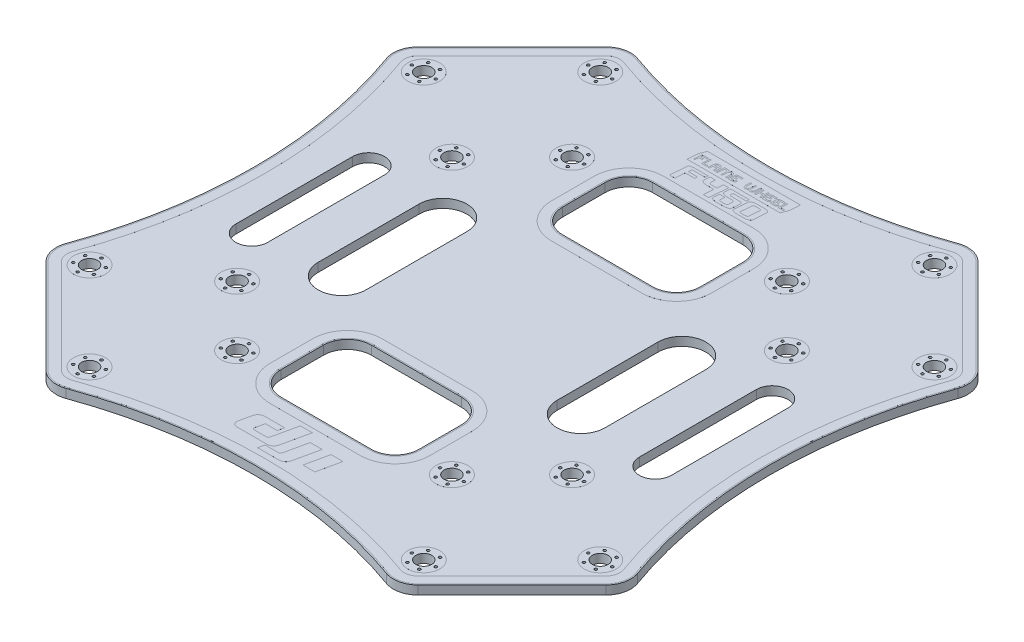
from build123d import *

# Parameters (mm, degrees)
BOSS_EXTRUDE1_DEPTH      = 0.825
BOSS_EXTRUDE1_DEPTH_BACK = 0.825
CUT_EXTRUDE1_DEPTH       = 1.65
SKETCH3_R                = 1.5
CUT_EXTRUDE2_DEPTH       = 1.65
BOSS_EXTRUDE2_START      = 0.001
SKETCH4_R                = 3
SKETCH4_R_2              = 0.25
SKETCH4_R_3              = 1.5
BOSS_EXTRUDE2_DEPTH      = 0.001
SKETCH5_R                = 0.25
CUT_EXTRUDE3_DEPTH       = 1.65
BOSS_EXTRUDE3_DEPTH      = 0.001


# Read off the part's stored shape, not the designer's step: Boss-Extrude3
with BuildPart() as part:
    # Sketch1 → Boss-Extrude1 (new, two sides: drawn at the far end of the back side and taken through both)
    with BuildSketch(Plane(origin=(0, 0, 0), x_dir=(1, 0, 0), z_dir=(0, 1, 0)).offset(-BOSS_EXTRUDE1_DEPTH_BACK)):
        with BuildLine():
            Line((35.046361717, 52.705589829), (52.705589829, 35.046361717))
            ThreePointArc((52.705589829, 35.046361717), (53.961944938, 32.762265708), (53.8, 30.160478519))
            ThreePointArc((53.8, 30.160478519), (48.55, 0), (53.8, -30.160478519))
            ThreePointArc((53.8, -30.160478519), (53.961944938, -32.762265708), (52.705589829, -35.046361717))
            Line((52.705589829, -35.046361717), (35.046361717, -52.705589829))
            ThreePointArc((35.046361717, -52.705589829), (32.762265708, -53.961944938), (30.160478519, -53.8))
            ThreePointArc((30.160478519, -53.8), (0, -48.55), (-30.160478519, -53.8))
            ThreePointArc((-30.160478519, -53.8), (-32.762265708, -53.961944938), (-35.046361717, -52.705589829))
            Line((-35.046361717, -52.705589829), (-52.705589829, -35.046361717))
            ThreePointArc((-52.705589829, -35.046361717), (-53.961944938, -32.762265708), (-53.8, -30.160478519))
            ThreePointArc((-53.8, -30.160478519), (-48.55, 0), (-53.8, 30.160478519))
            ThreePointArc((-53.8, 30.160478519), (-53.961944938, 32.762265708), (-52.705589829, 35.046361717))
            Line((-52.705589829, 35.046361717), (-35.046361717, 52.705589829))
            ThreePointArc((-35.046361717, 52.705589829), (-32.762265708, 53.961944938), (-30.160478519, 53.8))
            ThreePointArc((-30.160478519, 53.8), (0, 48.55), (30.160478519, 53.8))
            ThreePointArc((30.160478519, 53.8), (32.762265708, 53.961944938), (35.046361717, 52.705589829))
        make_face()
    extrude(amount=BOSS_EXTRUDE1_DEPTH + BOSS_EXTRUDE1_DEPTH_BACK)

    # Sketch2 → Cut-Extrude1 (cut)
    with BuildSketch(Plane(origin=(0, 0.825, 0), x_dir=(1, 0, 0), z_dir=(0, 1, 0))):
        with BuildLine():
            Line((13, 30.5), (13, 22.5))
            ThreePointArc((13, 22.5), (11.681980515, 19.318019485), (8.5, 18))
            Line((8.5, 18), (-8.5, 18))
            ThreePointArc((-8.5, 18), (-11.681980515, 19.318019485), (-13, 22.5))
            Line((-13, 22.5), (-13, 30.5))
            ThreePointArc((-13, 30.5), (-11.681980515, 33.681980515), (-8.5, 35))
            Line((-8.5, 35), (8.5, 35))
            ThreePointArc((8.5, 35), (11.681980515, 33.681980515), (13, 30.5))
        make_face()
        with BuildLine():
            Line((-13, -22.5), (-13, -30.5))
            ThreePointArc((-13, -30.5), (-11.681980515, -33.681980515), (-8.5, -35))
            Line((-8.5, -35), (8.5, -35))
            ThreePointArc((8.5, -35), (11.681980515, -33.681980515), (13, -30.5))
            Line((13, -30.5), (13, -22.5))
            ThreePointArc((13, -22.5), (11.681980515, -19.318019485), (8.5, -18))
            Line((8.5, -18), (-8.5, -18))
            ThreePointArc((-8.5, -18), (-11.681980515, -19.318019485), (-13, -22.5))
        make_face()
        with BuildLine():
            Line((-27, -9.5), (-27, 9.5))
            ThreePointArc((-27, 9.5), (-22.5, 14), (-18, 9.5))
            Line((-18, 9.5), (-18, -9.5))
            ThreePointArc((-18, -9.5), (-22.5, -14), (-27, -9.5))
        make_face()
        with BuildLine():
            Line((18, -9.5), (18, 9.5))
            ThreePointArc((18, 9.5), (22.5, 14), (27, 9.5))
            Line((27, 9.5), (27, -9.5))
            ThreePointArc((27, -9.5), (22.5, -14), (18, -9.5))
        make_face()
        with BuildLine():
            Line((-35, 11), (-35, -11))
            ThreePointArc((-35, -11), (-38, -14), (-41, -11))
            Line((-41, -11), (-41, 11))
            ThreePointArc((-41, 11), (-38, 14), (-35, 11))
        make_face()
        with BuildLine():
            Line((35, 11), (35, -11))
            ThreePointArc((35, -11), (38, -14), (41, -11))
            Line((41, -11), (41, 11))
            ThreePointArc((41, 11), (38, 14), (35, 11))
        make_face()
    extrude(amount=-CUT_EXTRUDE1_DEPTH, mode=Mode.SUBTRACT)

    # Sketch3 → Cut-Extrude2 (cut)
    with BuildSketch(Plane(origin=(0, 0.825, 0), x_dir=(1, 0, 0), z_dir=(0, 1, 0))):
        with Locations(Location((-48.083261121, -31.466251763, 0), (0, 0, 270))):
            Circle(SKETCH3_R)
        with Locations(Location((-31.466251763, -48.083261121, 0), (0, 0, 270))):
            Circle(SKETCH3_R)
        with Locations(Location((31.466251763, -48.083261121, 0), (0, 0, 270))):
            Circle(SKETCH3_R)
        with Locations(Location((48.083261121, -31.466251763, 0), (0, 0, 270))):
            Circle(SKETCH3_R)
        with Locations(Location((48.083261121, 31.466251763, 0), (0, 0, 270))):
            Circle(SKETCH3_R)
        with Locations(Location((31.466251763, 48.083261121, 0), (0, 0, 270))):
            Circle(SKETCH3_R)
        with Locations(Location((-31.466251763, 48.083261121, 0), (0, 0, 270))):
            Circle(SKETCH3_R)
        with Locations(Location((-48.083261121, 31.466251763, 0), (0, 0, 270))):
            Circle(SKETCH3_R)
        with Locations(Location((-31.540291459, -20.22658296, 0), (0, 0, 270))):
            Circle(SKETCH3_R)
        with Locations(Location((-20.22658296, -31.540291459, 0), (0, 0, 270))):
            Circle(SKETCH3_R)
        with Locations(Location((-31.540291459, 20.22658296, 0), (0, 0, 270))):
            Circle(SKETCH3_R)
        with Locations(Location((-20.22658296, 31.540291459, 0), (0, 0, 270))):
            Circle(SKETCH3_R)
        with Locations(Location((20.22658296, 31.540291459, 0), (0, 0, 270))):
            Circle(SKETCH3_R)
        with Locations(Location((31.540291459, 20.22658296, 0), (0, 0, 270))):
            Circle(SKETCH3_R)
        with Locations(Location((31.540291459, -20.22658296, 0), (0, 0, 270))):
            Circle(SKETCH3_R)
        with Locations(Location((20.22658296, -31.540291459, 0), (0, 0, 270))):
            Circle(SKETCH3_R)
    extrude(amount=-CUT_EXTRUDE2_DEPTH, mode=Mode.SUBTRACT)

    # Sketch4 → Boss-Extrude2 (add)
    # profile 1 of 19: a face of its own
    with BuildSketch(Plane(origin=(0, 0.825, 0), x_dir=(1, 0, 0), z_dir=(0, 1, 0)).offset(BOSS_EXTRUDE2_START)):
        with BuildLine():
            ThreePointArc((30.244953362, -53.564704439), (32.707621199, -53.71799007), (34.869585021, -52.528813133))
            Line((34.869585021, -52.528813133), (52.528813133, -34.869585021))
            ThreePointArc((52.528813133, -34.869585021), (53.71799007, -32.707621199), (53.564704439, -30.244953362))
            ThreePointArc((53.564704439, -30.244953362), (48.3, 0), (53.564704439, 30.244953362))
            ThreePointArc((53.564704439, 30.244953362), (53.71799007, 32.707621199), (52.528813133, 34.869585021))
            Line((52.528813133, 34.869585021), (34.869585021, 52.528813133))
            ThreePointArc((34.869585021, 52.528813133), (32.707621199, 53.71799007), (30.244953362, 53.564704439))
            ThreePointArc((30.244953362, 53.564704439), (0, 48.3), (-30.244953362, 53.564704439))
            ThreePointArc((-30.244953362, 53.564704439), (-32.707621199, 53.71799007), (-34.869585021, 52.528813133))
            Line((-34.869585021, 52.528813133), (-52.528813133, 34.869585021))
            ThreePointArc((-52.528813133, 34.869585021), (-53.71799007, 32.707621199), (-53.564704439, 30.244953362))
            ThreePointArc((-53.564704439, 30.244953362), (-48.3, 0), (-53.564704439, -30.244953362))
            ThreePointArc((-53.564704439, -30.244953362), (-53.71799007, -32.707621199), (-52.528813133, -34.869585021))
            Line((-52.528813133, -34.869585021), (-34.869585021, -52.528813133))
            ThreePointArc((-34.869585021, -52.528813133), (-32.707621199, -53.71799007), (-30.244953362, -53.564704439))
            ThreePointArc((-30.244953362, -53.564704439), (0, -48.3), (30.244953362, -53.564704439))
        make_face()
        with BuildLine():
            ThreePointArc((-51.870576403, 30.853172233), (-51.961515021, 32.314180733), (-51.256020927, 33.596792815))
            Line((-51.256020927, 33.596792815), (-33.596792815, 51.256020927))
            ThreePointArc((-33.596792815, 51.256020927), (-32.314180733, 51.961515021), (-30.853172233, 51.870576403))
            ThreePointArc((-30.853172233, 51.870576403), (0, 46.5), (30.853172233, 51.870576403))
            ThreePointArc((30.853172233, 51.870576403), (32.314180733, 51.961515021), (33.596792815, 51.256020927))
            Line((33.596792815, 51.256020927), (51.256020927, 33.596792815))
            ThreePointArc((51.256020927, 33.596792815), (51.961515021, 32.314180733), (51.870576403, 30.853172233))
            ThreePointArc((51.870576403, 30.853172233), (46.5, 0), (51.870576403, -30.853172233))
            ThreePointArc((51.870576403, -30.853172233), (51.961515021, -32.314180733), (51.256020927, -33.596792815))
            Line((51.256020927, -33.596792815), (33.596792815, -51.256020927))
            ThreePointArc((33.596792815, -51.256020927), (32.314180733, -51.961515021), (30.853172233, -51.870576403))
            ThreePointArc((30.853172233, -51.870576403), (0, -46.5), (-30.853172233, -51.870576403))
            ThreePointArc((-30.853172233, -51.870576403), (-32.314180733, -51.961515021), (-33.596792815, -51.256020927))
            Line((-33.596792815, -51.256020927), (-51.256020927, -33.596792815))
            ThreePointArc((-51.256020927, -33.596792815), (-51.961515021, -32.314180733), (-51.870576403, -30.853172233))
            ThreePointArc((-51.870576403, -30.853172233), (-46.5, 0), (-51.870576403, 30.853172233))
        make_face(mode=Mode.SUBTRACT)
    # profile 2 of 19: a face of its own
    with BuildSketch(Plane(origin=(0, 0.825, 0), x_dir=(1, 0, 0), z_dir=(0, 1, 0)).offset(BOSS_EXTRUDE2_START)):
        with BuildLine():
            Line((15.05, 22.5), (15.05, 30.5))
            ThreePointArc((15.05, 30.5), (13.131549417, 35.131549417), (8.5, 37.05))
            Line((8.5, 37.05), (-8.5, 37.05))
            ThreePointArc((-8.5, 37.05), (-13.131549417, 35.131549417), (-15.05, 30.5))
            Line((-15.05, 30.5), (-15.05, 22.5))
            ThreePointArc((-15.05, 22.5), (-13.131549417, 17.868450583), (-8.5, 15.95))
            Line((-8.5, 15.95), (8.5, 15.95))
            ThreePointArc((8.5, 15.95), (13.131549417, 17.868450583), (15.05, 22.5))
        make_face()
        with BuildLine():
            Line((8.5, 17.75), (-8.5, 17.75))
            ThreePointArc((-8.5, 17.75), (-11.858757211, 19.141242789), (-13.25, 22.5))
            Line((-13.25, 22.5), (-13.25, 30.5))
            ThreePointArc((-13.25, 30.5), (-11.858757211, 33.858757211), (-8.5, 35.25))
            Line((-8.5, 35.25), (8.5, 35.25))
            ThreePointArc((8.5, 35.25), (11.858757211, 33.858757211), (13.25, 30.5))
            Line((13.25, 30.5), (13.25, 22.5))
            ThreePointArc((13.25, 22.5), (11.858757211, 19.141242789), (8.5, 17.75))
        make_face(mode=Mode.SUBTRACT)
    # profile 3 of 19: a face of its own
    with BuildSketch(Plane(origin=(0, 0.825, 0), x_dir=(1, 0, 0), z_dir=(0, 1, 0)).offset(BOSS_EXTRUDE2_START)):
        with BuildLine():
            ThreePointArc((8.5, -37.05), (13.131549417, -35.131549417), (15.05, -30.5))
            Line((15.05, -30.5), (15.05, -22.5))
            ThreePointArc((15.05, -22.5), (13.131549417, -17.868450583), (8.5, -15.95))
            Line((8.5, -15.95), (-8.5, -15.95))
            ThreePointArc((-8.5, -15.95), (-13.131549417, -17.868450583), (-15.05, -22.5))
            Line((-15.05, -22.5), (-15.05, -30.5))
            ThreePointArc((-15.05, -30.5), (-13.131549417, -35.131549417), (-8.5, -37.05))
            Line((-8.5, -37.05), (8.5, -37.05))
        make_face()
        with BuildLine():
            Line((13.25, -22.5), (13.25, -30.5))
            ThreePointArc((13.25, -30.5), (11.858757211, -33.858757211), (8.5, -35.25))
            Line((8.5, -35.25), (-8.5, -35.25))
            ThreePointArc((-8.5, -35.25), (-11.858757211, -33.858757211), (-13.25, -30.5))
            Line((-13.25, -30.5), (-13.25, -22.5))
            ThreePointArc((-13.25, -22.5), (-11.858757211, -19.141242789), (-8.5, -17.75))
            Line((-8.5, -17.75), (8.5, -17.75))
            ThreePointArc((8.5, -17.75), (11.858757211, -19.141242789), (13.25, -22.5))
        make_face(mode=Mode.SUBTRACT)
    # profile 4 of 19: a face of its own
    with BuildSketch(Plane(origin=(0, 0.825, 0), x_dir=(1, 0, 0), z_dir=(0, 1, 0)).offset(BOSS_EXTRUDE2_START)):
        with Locations(Location((-31.466251763, -48.083261121, 0), (0, 0, 270))):
            Circle(SKETCH4_R)
        with Locations(Location((-33.414808921, -49.208261121, 0), (0, 0, 270))):
            Circle(SKETCH4_R_2, mode=Mode.SUBTRACT)
        with Locations(Location((-31.466251763, -50.333261121, 0), (0, 0, 270))):
            Circle(SKETCH4_R_2, mode=Mode.SUBTRACT)
        with Locations(Location((-31.466251763, -48.083261121, 0), (0, 0, 270))):
            Circle(SKETCH4_R_3, mode=Mode.SUBTRACT)
        with Locations(Location((-29.517694604, -49.208261121, 0), (0, 0, 270))):
            Circle(SKETCH4_R_2, mode=Mode.SUBTRACT)
        with Locations(Location((-33.414808921, -46.958261121, 0), (0, 0, 270))):
            Circle(SKETCH4_R_2, mode=Mode.SUBTRACT)
        with Locations(Location((-31.466251763, -45.833261121, 0), (0, 0, 270))):
            Circle(SKETCH4_R_2, mode=Mode.SUBTRACT)
        with Locations(Location((-29.517694604, -46.958261121, 0), (0, 0, 270))):
            Circle(SKETCH4_R_2, mode=Mode.SUBTRACT)
    # profile 5 of 19: a face of its own
    with BuildSketch(Plane(origin=(0, 0.825, 0), x_dir=(1, 0, 0), z_dir=(0, 1, 0)).offset(BOSS_EXTRUDE2_START)):
        with Locations(Location((-48.083261121, -31.466251763, 0), (0, 0, 270))):
            Circle(SKETCH4_R)
        with Locations(Location((-48.083261121, -33.716251763, 0), (0, 0, 270))):
            Circle(SKETCH4_R_2, mode=Mode.SUBTRACT)
        with Locations(Location((-50.031818279, -32.591251763, 0), (0, 0, 270))):
            Circle(SKETCH4_R_2, mode=Mode.SUBTRACT)
        with Locations(Location((-50.031818279, -30.341251763, 0), (0, 0, 270))):
            Circle(SKETCH4_R_2, mode=Mode.SUBTRACT)
        with Locations(Location((-48.083261121, -31.466251763, 0), (0, 0, 270))):
            Circle(SKETCH4_R_3, mode=Mode.SUBTRACT)
        with Locations(Location((-48.083261121, -29.216251763, 0), (0, 0, 270))):
            Circle(SKETCH4_R_2, mode=Mode.SUBTRACT)
        with Locations(Location((-46.134703962, -32.591251763, 0), (0, 0, 270))):
            Circle(SKETCH4_R_2, mode=Mode.SUBTRACT)
        with Locations(Location((-46.134703962, -30.341251763, 0), (0, 0, 270))):
            Circle(SKETCH4_R_2, mode=Mode.SUBTRACT)
    # profile 6 of 19: a face of its own
    with BuildSketch(Plane(origin=(0, 0.825, 0), x_dir=(1, 0, 0), z_dir=(0, 1, 0)).offset(BOSS_EXTRUDE2_START)):
        with Locations(Location((-31.540291459, -20.22658296, 0), (0, 0, 270))):
            Circle(SKETCH4_R)
        with Locations(Location((-31.540291459, -22.47658296, 0), (0, 0, 270))):
            Circle(SKETCH4_R_2, mode=Mode.SUBTRACT)
        with Locations(Location((-33.488848618, -21.35158296, 0), (0, 0, 270))):
            Circle(SKETCH4_R_2, mode=Mode.SUBTRACT)
        with Locations(Location((-31.540291459, -20.22658296, 0), (0, 0, 270))):
            Circle(SKETCH4_R_3, mode=Mode.SUBTRACT)
        with Locations(Location((-29.591734301, -21.35158296, 0), (0, 0, 270))):
            Circle(SKETCH4_R_2, mode=Mode.SUBTRACT)
        with Locations(Location((-33.488848618, -19.10158296, 0), (0, 0, 270))):
            Circle(SKETCH4_R_2, mode=Mode.SUBTRACT)
        with Locations(Location((-31.540291459, -17.97658296, 0), (0, 0, 270))):
            Circle(SKETCH4_R_2, mode=Mode.SUBTRACT)
        with Locations(Location((-29.591734301, -19.10158296, 0), (0, 0, 270))):
            Circle(SKETCH4_R_2, mode=Mode.SUBTRACT)
    # profile 7 of 19: a face of its own
    with BuildSketch(Plane(origin=(0, 0.825, 0), x_dir=(1, 0, 0), z_dir=(0, 1, 0)).offset(BOSS_EXTRUDE2_START)):
        with Locations(Location((-20.22658296, -31.540291459, 0), (0, 0, 270))):
            Circle(SKETCH4_R)
        with Locations(Location((-20.22658296, -33.790291459, 0), (0, 0, 270))):
            Circle(SKETCH4_R_2, mode=Mode.SUBTRACT)
        with Locations(Location((-22.175140119, -32.665291459, 0), (0, 0, 270))):
            Circle(SKETCH4_R_2, mode=Mode.SUBTRACT)
        with Locations(Location((-22.175140119, -30.415291459, 0), (0, 0, 270))):
            Circle(SKETCH4_R_2, mode=Mode.SUBTRACT)
        with Locations(Location((-20.22658296, -31.540291459, 0), (0, 0, 270))):
            Circle(SKETCH4_R_3, mode=Mode.SUBTRACT)
        with Locations(Location((-20.22658296, -29.290291459, 0), (0, 0, 270))):
            Circle(SKETCH4_R_2, mode=Mode.SUBTRACT)
        with Locations(Location((-18.278025802, -32.665291459, 0), (0, 0, 270))):
            Circle(SKETCH4_R_2, mode=Mode.SUBTRACT)
        with Locations(Location((-18.278025802, -30.415291459, 0), (0, 0, 270))):
            Circle(SKETCH4_R_2, mode=Mode.SUBTRACT)
    # profile 8 of 19: a face of its own
    with BuildSketch(Plane(origin=(0, 0.825, 0), x_dir=(1, 0, 0), z_dir=(0, 1, 0)).offset(BOSS_EXTRUDE2_START)):
        with Locations(Location((-48.083261121, 31.466251763, 0), (0, 0, 270))):
            Circle(SKETCH4_R)
        with Locations(Location((-49.208261121, 29.517694604, 0), (0, 0, 270))):
            Circle(SKETCH4_R_2, mode=Mode.SUBTRACT)
        with Locations(Location((-50.333261121, 31.466251763, 0), (0, 0, 270))):
            Circle(SKETCH4_R_2, mode=Mode.SUBTRACT)
        with Locations(Location((-48.083261121, 31.466251763, 0), (0, 0, 270))):
            Circle(SKETCH4_R_3, mode=Mode.SUBTRACT)
        with Locations(Location((-49.208261121, 33.414808921, 0), (0, 0, 270))):
            Circle(SKETCH4_R_2, mode=Mode.SUBTRACT)
        with Locations(Location((-46.958261121, 29.517694604, 0), (0, 0, 270))):
            Circle(SKETCH4_R_2, mode=Mode.SUBTRACT)
        with Locations(Location((-45.833261121, 31.466251763, 0), (0, 0, 270))):
            Circle(SKETCH4_R_2, mode=Mode.SUBTRACT)
        with Locations(Location((-46.958261121, 33.414808921, 0), (0, 0, 270))):
            Circle(SKETCH4_R_2, mode=Mode.SUBTRACT)
    # profile 9 of 19: a face of its own
    with BuildSketch(Plane(origin=(0, 0.825, 0), x_dir=(1, 0, 0), z_dir=(0, 1, 0)).offset(BOSS_EXTRUDE2_START)):
        with Locations(Location((-31.540291459, 20.22658296, 0), (0, 0, 270))):
            Circle(SKETCH4_R)
        with Locations(Location((-32.665291459, 18.278025802, 0), (0, 0, 270))):
            Circle(SKETCH4_R_2, mode=Mode.SUBTRACT)
        with Locations(Location((-30.415291459, 18.278025802, 0), (0, 0, 270))):
            Circle(SKETCH4_R_2, mode=Mode.SUBTRACT)
        with Locations(Location((-33.790291459, 20.22658296, 0), (0, 0, 270))):
            Circle(SKETCH4_R_2, mode=Mode.SUBTRACT)
        with Locations(Location((-31.540291459, 20.22658296, 0), (0, 0, 270))):
            Circle(SKETCH4_R_3, mode=Mode.SUBTRACT)
        with Locations(Location((-32.665291459, 22.175140119, 0), (0, 0, 270))):
            Circle(SKETCH4_R_2, mode=Mode.SUBTRACT)
        with Locations(Location((-30.415291459, 22.175140119, 0), (0, 0, 270))):
            Circle(SKETCH4_R_2, mode=Mode.SUBTRACT)
        with Locations(Location((-29.290291459, 20.22658296, 0), (0, 0, 270))):
            Circle(SKETCH4_R_2, mode=Mode.SUBTRACT)
    # profile 10 of 19: a face of its own
    with BuildSketch(Plane(origin=(0, 0.825, 0), x_dir=(1, 0, 0), z_dir=(0, 1, 0)).offset(BOSS_EXTRUDE2_START)):
        with Locations(Location((-20.22658296, 31.540291459, 0), (0, 0, 270))):
            Circle(SKETCH4_R)
        with Locations(Location((-21.35158296, 29.591734301, 0), (0, 0, 270))):
            Circle(SKETCH4_R_2, mode=Mode.SUBTRACT)
        with Locations(Location((-22.47658296, 31.540291459, 0), (0, 0, 270))):
            Circle(SKETCH4_R_2, mode=Mode.SUBTRACT)
        with Locations(Location((-20.22658296, 31.540291459, 0), (0, 0, 270))):
            Circle(SKETCH4_R_3, mode=Mode.SUBTRACT)
        with Locations(Location((-21.35158296, 33.488848618, 0), (0, 0, 270))):
            Circle(SKETCH4_R_2, mode=Mode.SUBTRACT)
        with Locations(Location((-19.10158296, 29.591734301, 0), (0, 0, 270))):
            Circle(SKETCH4_R_2, mode=Mode.SUBTRACT)
        with Locations(Location((-17.97658296, 31.540291459, 0), (0, 0, 270))):
            Circle(SKETCH4_R_2, mode=Mode.SUBTRACT)
        with Locations(Location((-19.10158296, 33.488848618, 0), (0, 0, 270))):
            Circle(SKETCH4_R_2, mode=Mode.SUBTRACT)
    # profile 11 of 19: a face of its own
    with BuildSketch(Plane(origin=(0, 0.825, 0), x_dir=(1, 0, 0), z_dir=(0, 1, 0)).offset(BOSS_EXTRUDE2_START)):
        with Locations(Location((-31.466251763, 48.083261121, 0), (0, 0, 270))):
            Circle(SKETCH4_R)
        with Locations(Location((-32.591251763, 46.134703962, 0), (0, 0, 270))):
            Circle(SKETCH4_R_2, mode=Mode.SUBTRACT)
        with Locations(Location((-30.341251763, 46.134703962, 0), (0, 0, 270))):
            Circle(SKETCH4_R_2, mode=Mode.SUBTRACT)
        with Locations(Location((-33.716251763, 48.083261121, 0), (0, 0, 270))):
            Circle(SKETCH4_R_2, mode=Mode.SUBTRACT)
        with Locations(Location((-31.466251763, 48.083261121, 0), (0, 0, 270))):
            Circle(SKETCH4_R_3, mode=Mode.SUBTRACT)
        with Locations(Location((-32.591251763, 50.031818279, 0), (0, 0, 270))):
            Circle(SKETCH4_R_2, mode=Mode.SUBTRACT)
        with Locations(Location((-30.341251763, 50.031818279, 0), (0, 0, 270))):
            Circle(SKETCH4_R_2, mode=Mode.SUBTRACT)
        with Locations(Location((-29.216251763, 48.083261121, 0), (0, 0, 270))):
            Circle(SKETCH4_R_2, mode=Mode.SUBTRACT)
    # profile 12 of 19: a face of its own
    with BuildSketch(Plane(origin=(0, 0.825, 0), x_dir=(1, 0, 0), z_dir=(0, 1, 0)).offset(BOSS_EXTRUDE2_START)):
        with Locations(Location((20.22658296, 31.540291459, 0), (0, 0, 270))):
            Circle(SKETCH4_R)
        with Locations(Location((18.278025802, 30.415291459, 0), (0, 0, 270))):
            Circle(SKETCH4_R_2, mode=Mode.SUBTRACT)
        with Locations(Location((18.278025802, 32.665291459, 0), (0, 0, 270))):
            Circle(SKETCH4_R_2, mode=Mode.SUBTRACT)
        with Locations(Location((20.22658296, 29.290291459, 0), (0, 0, 270))):
            Circle(SKETCH4_R_2, mode=Mode.SUBTRACT)
        with Locations(Location((20.22658296, 31.540291459, 0), (0, 0, 270))):
            Circle(SKETCH4_R_3, mode=Mode.SUBTRACT)
        with Locations(Location((22.175140119, 30.415291459, 0), (0, 0, 270))):
            Circle(SKETCH4_R_2, mode=Mode.SUBTRACT)
        with Locations(Location((22.175140119, 32.665291459, 0), (0, 0, 270))):
            Circle(SKETCH4_R_2, mode=Mode.SUBTRACT)
        with Locations(Location((20.22658296, 33.790291459, 0), (0, 0, 270))):
            Circle(SKETCH4_R_2, mode=Mode.SUBTRACT)
    # profile 13 of 19: a face of its own
    with BuildSketch(Plane(origin=(0, 0.825, 0), x_dir=(1, 0, 0), z_dir=(0, 1, 0)).offset(BOSS_EXTRUDE2_START)):
        with Locations(Location((31.466251763, 48.083261121, 0), (0, 0, 270))):
            Circle(SKETCH4_R)
        with Locations(Location((29.517694604, 46.958261121, 0), (0, 0, 270))):
            Circle(SKETCH4_R_2, mode=Mode.SUBTRACT)
        with Locations(Location((31.466251763, 45.833261121, 0), (0, 0, 270))):
            Circle(SKETCH4_R_2, mode=Mode.SUBTRACT)
        with Locations(Location((33.414808921, 46.958261121, 0), (0, 0, 270))):
            Circle(SKETCH4_R_2, mode=Mode.SUBTRACT)
        with Locations(Location((29.517694604, 49.208261121, 0), (0, 0, 270))):
            Circle(SKETCH4_R_2, mode=Mode.SUBTRACT)
        with Locations(Location((31.466251763, 48.083261121, 0), (0, 0, 270))):
            Circle(SKETCH4_R_3, mode=Mode.SUBTRACT)
        with Locations(Location((31.466251763, 50.333261121, 0), (0, 0, 270))):
            Circle(SKETCH4_R_2, mode=Mode.SUBTRACT)
        with Locations(Location((33.414808921, 49.208261121, 0), (0, 0, 270))):
            Circle(SKETCH4_R_2, mode=Mode.SUBTRACT)
    # profile 14 of 19: a face of its own
    with BuildSketch(Plane(origin=(0, 0.825, 0), x_dir=(1, 0, 0), z_dir=(0, 1, 0)).offset(BOSS_EXTRUDE2_START)):
        with Locations(Location((48.083261121, 31.466251763, 0), (0, 0, 270))):
            Circle(SKETCH4_R)
        with Locations(Location((46.134703962, 30.341251763, 0), (0, 0, 270))):
            Circle(SKETCH4_R_2, mode=Mode.SUBTRACT)
        with Locations(Location((46.134703962, 32.591251763, 0), (0, 0, 270))):
            Circle(SKETCH4_R_2, mode=Mode.SUBTRACT)
        with Locations(Location((48.083261121, 29.216251763, 0), (0, 0, 270))):
            Circle(SKETCH4_R_2, mode=Mode.SUBTRACT)
        with Locations(Location((48.083261121, 31.466251763, 0), (0, 0, 270))):
            Circle(SKETCH4_R_3, mode=Mode.SUBTRACT)
        with Locations(Location((50.031818279, 30.341251763, 0), (0, 0, 270))):
            Circle(SKETCH4_R_2, mode=Mode.SUBTRACT)
        with Locations(Location((50.031818279, 32.591251763, 0), (0, 0, 270))):
            Circle(SKETCH4_R_2, mode=Mode.SUBTRACT)
        with Locations(Location((48.083261121, 33.716251763, 0), (0, 0, 270))):
            Circle(SKETCH4_R_2, mode=Mode.SUBTRACT)
    # profile 15 of 19: a face of its own
    with BuildSketch(Plane(origin=(0, 0.825, 0), x_dir=(1, 0, 0), z_dir=(0, 1, 0)).offset(BOSS_EXTRUDE2_START)):
        with Locations(Location((31.540291459, 20.22658296, 0), (0, 0, 270))):
            Circle(SKETCH4_R)
        with Locations(Location((29.591734301, 19.10158296, 0), (0, 0, 270))):
            Circle(SKETCH4_R_2, mode=Mode.SUBTRACT)
        with Locations(Location((31.540291459, 17.97658296, 0), (0, 0, 270))):
            Circle(SKETCH4_R_2, mode=Mode.SUBTRACT)
        with Locations(Location((33.488848618, 19.10158296, 0), (0, 0, 270))):
            Circle(SKETCH4_R_2, mode=Mode.SUBTRACT)
        with Locations(Location((29.591734301, 21.35158296, 0), (0, 0, 270))):
            Circle(SKETCH4_R_2, mode=Mode.SUBTRACT)
        with Locations(Location((31.540291459, 20.22658296, 0), (0, 0, 270))):
            Circle(SKETCH4_R_3, mode=Mode.SUBTRACT)
        with Locations(Location((33.488848618, 21.35158296, 0), (0, 0, 270))):
            Circle(SKETCH4_R_2, mode=Mode.SUBTRACT)
        with Locations(Location((31.540291459, 22.47658296, 0), (0, 0, 270))):
            Circle(SKETCH4_R_2, mode=Mode.SUBTRACT)
    # profile 16 of 19: a face of its own
    with BuildSketch(Plane(origin=(0, 0.825, 0), x_dir=(1, 0, 0), z_dir=(0, 1, 0)).offset(BOSS_EXTRUDE2_START)):
        with Locations(Location((20.22658296, -31.540291459, 0), (0, 0, 270))):
            Circle(SKETCH4_R)
        with Locations(Location((19.10158296, -33.488848618, 0), (0, 0, 270))):
            Circle(SKETCH4_R_2, mode=Mode.SUBTRACT)
        with Locations(Location((17.97658296, -31.540291459, 0), (0, 0, 270))):
            Circle(SKETCH4_R_2, mode=Mode.SUBTRACT)
        with Locations(Location((19.10158296, -29.591734301, 0), (0, 0, 270))):
            Circle(SKETCH4_R_2, mode=Mode.SUBTRACT)
        with Locations(Location((21.35158296, -33.488848618, 0), (0, 0, 270))):
            Circle(SKETCH4_R_2, mode=Mode.SUBTRACT)
        with Locations(Location((20.22658296, -31.540291459, 0), (0, 0, 270))):
            Circle(SKETCH4_R_3, mode=Mode.SUBTRACT)
        with Locations(Location((22.47658296, -31.540291459, 0), (0, 0, 270))):
            Circle(SKETCH4_R_2, mode=Mode.SUBTRACT)
        with Locations(Location((21.35158296, -29.591734301, 0), (0, 0, 270))):
            Circle(SKETCH4_R_2, mode=Mode.SUBTRACT)
    # profile 17 of 19: a face of its own
    with BuildSketch(Plane(origin=(0, 0.825, 0), x_dir=(1, 0, 0), z_dir=(0, 1, 0)).offset(BOSS_EXTRUDE2_START)):
        with Locations(Location((31.540291459, -20.22658296, 0), (0, 0, 270))):
            Circle(SKETCH4_R)
        with Locations(Location((29.290291459, -20.22658296, 0), (0, 0, 270))):
            Circle(SKETCH4_R_2, mode=Mode.SUBTRACT)
        with Locations(Location((30.415291459, -22.175140119, 0), (0, 0, 270))):
            Circle(SKETCH4_R_2, mode=Mode.SUBTRACT)
        with Locations(Location((32.665291459, -22.175140119, 0), (0, 0, 270))):
            Circle(SKETCH4_R_2, mode=Mode.SUBTRACT)
        with Locations(Location((31.540291459, -20.22658296, 0), (0, 0, 270))):
            Circle(SKETCH4_R_3, mode=Mode.SUBTRACT)
        with Locations(Location((33.790291459, -20.22658296, 0), (0, 0, 270))):
            Circle(SKETCH4_R_2, mode=Mode.SUBTRACT)
        with Locations(Location((30.415291459, -18.278025802, 0), (0, 0, 270))):
            Circle(SKETCH4_R_2, mode=Mode.SUBTRACT)
        with Locations(Location((32.665291459, -18.278025802, 0), (0, 0, 270))):
            Circle(SKETCH4_R_2, mode=Mode.SUBTRACT)
    # profile 18 of 19: a face of its own
    with BuildSketch(Plane(origin=(0, 0.825, 0), x_dir=(1, 0, 0), z_dir=(0, 1, 0)).offset(BOSS_EXTRUDE2_START)):
        with Locations(Location((48.083261121, -31.466251763, 0), (0, 0, 270))):
            Circle(SKETCH4_R)
        with Locations(Location((46.958261121, -33.414808921, 0), (0, 0, 270))):
            Circle(SKETCH4_R_2, mode=Mode.SUBTRACT)
        with Locations(Location((45.833261121, -31.466251763, 0), (0, 0, 270))):
            Circle(SKETCH4_R_2, mode=Mode.SUBTRACT)
        with Locations(Location((46.958261121, -29.517694604, 0), (0, 0, 270))):
            Circle(SKETCH4_R_2, mode=Mode.SUBTRACT)
        with Locations(Location((49.208261121, -33.414808921, 0), (0, 0, 270))):
            Circle(SKETCH4_R_2, mode=Mode.SUBTRACT)
        with Locations(Location((48.083261121, -31.466251763, 0), (0, 0, 270))):
            Circle(SKETCH4_R_3, mode=Mode.SUBTRACT)
        with Locations(Location((50.333261121, -31.466251763, 0), (0, 0, 270))):
            Circle(SKETCH4_R_2, mode=Mode.SUBTRACT)
        with Locations(Location((49.208261121, -29.517694604, 0), (0, 0, 270))):
            Circle(SKETCH4_R_2, mode=Mode.SUBTRACT)
    # profile 19 of 19: a face of its own
    with BuildSketch(Plane(origin=(0, 0.825, 0), x_dir=(1, 0, 0), z_dir=(0, 1, 0)).offset(BOSS_EXTRUDE2_START)):
        with Locations(Location((31.466251763, -48.083261121, 0), (0, 0, 270))):
            Circle(SKETCH4_R)
        with Locations(Location((29.216251763, -48.083261121, 0), (0, 0, 270))):
            Circle(SKETCH4_R_2, mode=Mode.SUBTRACT)
        with Locations(Location((30.341251763, -50.031818279, 0), (0, 0, 270))):
            Circle(SKETCH4_R_2, mode=Mode.SUBTRACT)
        with Locations(Location((32.591251763, -50.031818279, 0), (0, 0, 270))):
            Circle(SKETCH4_R_2, mode=Mode.SUBTRACT)
        with Locations(Location((31.466251763, -48.083261121, 0), (0, 0, 270))):
            Circle(SKETCH4_R_3, mode=Mode.SUBTRACT)
        with Locations(Location((33.716251763, -48.083261121, 0), (0, 0, 270))):
            Circle(SKETCH4_R_2, mode=Mode.SUBTRACT)
        with Locations(Location((30.341251763, -46.134703962, 0), (0, 0, 270))):
            Circle(SKETCH4_R_2, mode=Mode.SUBTRACT)
        with Locations(Location((32.591251763, -46.134703962, 0), (0, 0, 270))):
            Circle(SKETCH4_R_2, mode=Mode.SUBTRACT)
    boss_extrude2 = extrude(amount=-BOSS_EXTRUDE2_DEPTH)

    # Mirror2: Boss-Extrude2 across plane
    add(boss_extrude2.mirror(Plane.ZX))

    # Sketch5 → Cut-Extrude3 (cut)
    with BuildSketch(Plane(origin=(0, 0.825, 0), x_dir=(1, 0, 0), z_dir=(0, 1, 0))):
        with Locations(Location((-31.466251763, -45.833261121, 0), (0, 0, 270))):
            Circle(SKETCH5_R)
        with Locations(Location((-29.517694604, -46.958261121, 0), (0, 0, 270))):
            Circle(SKETCH5_R)
        with Locations(Location((-29.517694604, -49.208261121, 0), (0, 0, 270))):
            Circle(SKETCH5_R)
        with Locations(Location((-31.466251763, -50.333261121, 0), (0, 0, 270))):
            Circle(SKETCH5_R)
        with Locations(Location((-33.414808921, -49.208261121, 0), (0, 0, 270))):
            Circle(SKETCH5_R)
        with Locations(Location((-33.414808921, -46.958261121, 0), (0, 0, 270))):
            Circle(SKETCH5_R)
        with Locations(Location((-48.083261121, -33.716251763, 0), (0, 0, 270))):
            Circle(SKETCH5_R)
        with Locations(Location((-50.031818279, -32.591251763, 0), (0, 0, 270))):
            Circle(SKETCH5_R)
        with Locations(Location((-50.031818279, -30.341251763, 0), (0, 0, 270))):
            Circle(SKETCH5_R)
        with Locations(Location((-48.083261121, -29.216251763, 0), (0, 0, 270))):
            Circle(SKETCH5_R)
        with Locations(Location((-46.134703962, -30.341251763, 0), (0, 0, 270))):
            Circle(SKETCH5_R)
        with Locations(Location((-46.134703962, -32.591251763, 0), (0, 0, 270))):
            Circle(SKETCH5_R)
        with Locations(Location((-33.488848618, -21.35158296, 0), (0, 0, 270))):
            Circle(SKETCH5_R)
        with Locations(Location((-33.488848618, -19.10158296, 0), (0, 0, 270))):
            Circle(SKETCH5_R)
        with Locations(Location((-31.540291459, -17.97658296, 0), (0, 0, 270))):
            Circle(SKETCH5_R)
        with Locations(Location((-29.591734301, -19.10158296, 0), (0, 0, 270))):
            Circle(SKETCH5_R)
        with Locations(Location((-29.591734301, -21.35158296, 0), (0, 0, 270))):
            Circle(SKETCH5_R)
        with Locations(Location((-31.540291459, -22.47658296, 0), (0, 0, 270))):
            Circle(SKETCH5_R)
        with Locations(Location((-22.175140119, -30.415291459, 0), (0, 0, 270))):
            Circle(SKETCH5_R)
        with Locations(Location((-22.175140119, -32.665291459, 0), (0, 0, 270))):
            Circle(SKETCH5_R)
        with Locations(Location((-20.22658296, -33.790291459, 0), (0, 0, 270))):
            Circle(SKETCH5_R)
        with Locations(Location((-18.278025802, -32.665291459, 0), (0, 0, 270))):
            Circle(SKETCH5_R)
        with Locations(Location((-18.278025802, -30.415291459, 0), (0, 0, 270))):
            Circle(SKETCH5_R)
        with Locations(Location((-20.22658296, -29.290291459, 0), (0, 0, 270))):
            Circle(SKETCH5_R)
        with Locations(Location((19.10158296, -33.488848618, 0), (0, 0, 270))):
            Circle(SKETCH5_R)
        with Locations(Location((17.97658296, -31.540291459, 0), (0, 0, 270))):
            Circle(SKETCH5_R)
        with Locations(Location((19.10158296, -29.591734301, 0), (0, 0, 270))):
            Circle(SKETCH5_R)
        with Locations(Location((21.35158296, -29.591734301, 0), (0, 0, 270))):
            Circle(SKETCH5_R)
        with Locations(Location((22.47658296, -31.540291459, 0), (0, 0, 270))):
            Circle(SKETCH5_R)
        with Locations(Location((21.35158296, -33.488848618, 0), (0, 0, 270))):
            Circle(SKETCH5_R)
        with Locations(Location((29.290291459, -20.22658296, 0), (0, 0, 270))):
            Circle(SKETCH5_R)
        with Locations(Location((30.415291459, -18.278025802, 0), (0, 0, 270))):
            Circle(SKETCH5_R)
        with Locations(Location((32.665291459, -18.278025802, 0), (0, 0, 270))):
            Circle(SKETCH5_R)
        with Locations(Location((30.415291459, -22.175140119, 0), (0, 0, 270))):
            Circle(SKETCH5_R)
        with Locations(Location((32.665291459, -22.175140119, 0), (0, 0, 270))):
            Circle(SKETCH5_R)
        with Locations(Location((33.790291459, -20.22658296, 0), (0, 0, 270))):
            Circle(SKETCH5_R)
        with Locations(Location((46.958261121, -29.517694604, 0), (0, 0, 270))):
            Circle(SKETCH5_R)
        with Locations(Location((49.208261121, -29.517694604, 0), (0, 0, 270))):
            Circle(SKETCH5_R)
        with Locations(Location((45.833261121, -31.466251763, 0), (0, 0, 270))):
            Circle(SKETCH5_R)
        with Locations(Location((46.958261121, -33.414808921, 0), (0, 0, 270))):
            Circle(SKETCH5_R)
        with Locations(Location((49.208261121, -33.414808921, 0), (0, 0, 270))):
            Circle(SKETCH5_R)
        with Locations(Location((50.333261121, -31.466251763, 0), (0, 0, 270))):
            Circle(SKETCH5_R)
        with Locations(Location((30.341251763, -46.134703962, 0), (0, 0, 270))):
            Circle(SKETCH5_R)
        with Locations(Location((32.591251763, -46.134703962, 0), (0, 0, 270))):
            Circle(SKETCH5_R)
        with Locations(Location((29.216251763, -48.083261121, 0), (0, 0, 270))):
            Circle(SKETCH5_R)
        with Locations(Location((30.341251763, -50.031818279, 0), (0, 0, 270))):
            Circle(SKETCH5_R)
        with Locations(Location((32.591251763, -50.031818279, 0), (0, 0, 270))):
            Circle(SKETCH5_R)
        with Locations(Location((33.716251763, -48.083261121, 0), (0, 0, 270))):
            Circle(SKETCH5_R)
        with Locations(Location((-32.665291459, 18.278025802, 0), (0, 0, 270))):
            Circle(SKETCH5_R)
        with Locations(Location((-33.790291459, 20.22658296, 0), (0, 0, 270))):
            Circle(SKETCH5_R)
        with Locations(Location((-32.665291459, 22.175140119, 0), (0, 0, 270))):
            Circle(SKETCH5_R)
        with Locations(Location((-30.415291459, 22.175140119, 0), (0, 0, 270))):
            Circle(SKETCH5_R)
        with Locations(Location((-29.290291459, 20.22658296, 0), (0, 0, 270))):
            Circle(SKETCH5_R)
        with Locations(Location((-30.415291459, 18.278025802, 0), (0, 0, 270))):
            Circle(SKETCH5_R)
        with Locations(Location((-49.208261121, 29.517694604, 0), (0, 0, 270))):
            Circle(SKETCH5_R)
        with Locations(Location((-50.333261121, 31.466251763, 0), (0, 0, 270))):
            Circle(SKETCH5_R)
        with Locations(Location((-49.208261121, 33.414808921, 0), (0, 0, 270))):
            Circle(SKETCH5_R)
        with Locations(Location((-46.958261121, 33.414808921, 0), (0, 0, 270))):
            Circle(SKETCH5_R)
        with Locations(Location((-45.833261121, 31.466251763, 0), (0, 0, 270))):
            Circle(SKETCH5_R)
        with Locations(Location((-46.958261121, 29.517694604, 0), (0, 0, 270))):
            Circle(SKETCH5_R)
        with Locations(Location((-32.591251763, 46.134703962, 0), (0, 0, 270))):
            Circle(SKETCH5_R)
        with Locations(Location((-33.716251763, 48.083261121, 0), (0, 0, 270))):
            Circle(SKETCH5_R)
        with Locations(Location((-32.591251763, 50.031818279, 0), (0, 0, 270))):
            Circle(SKETCH5_R)
        with Locations(Location((-30.341251763, 50.031818279, 0), (0, 0, 270))):
            Circle(SKETCH5_R)
        with Locations(Location((-29.216251763, 48.083261121, 0), (0, 0, 270))):
            Circle(SKETCH5_R)
        with Locations(Location((-30.341251763, 46.134703962, 0), (0, 0, 270))):
            Circle(SKETCH5_R)
        with Locations(Location((-21.35158296, 29.591734301, 0), (0, 0, 270))):
            Circle(SKETCH5_R)
        with Locations(Location((-22.47658296, 31.540291459, 0), (0, 0, 270))):
            Circle(SKETCH5_R)
        with Locations(Location((-21.35158296, 33.488848618, 0), (0, 0, 270))):
            Circle(SKETCH5_R)
        with Locations(Location((-19.10158296, 33.488848618, 0), (0, 0, 270))):
            Circle(SKETCH5_R)
        with Locations(Location((-17.97658296, 31.540291459, 0), (0, 0, 270))):
            Circle(SKETCH5_R)
        with Locations(Location((-19.10158296, 29.591734301, 0), (0, 0, 270))):
            Circle(SKETCH5_R)
        with Locations(Location((20.22658296, 29.290291459, 0), (0, 0, 270))):
            Circle(SKETCH5_R)
        with Locations(Location((18.278025802, 30.415291459, 0), (0, 0, 270))):
            Circle(SKETCH5_R)
        with Locations(Location((18.278025802, 32.665291459, 0), (0, 0, 270))):
            Circle(SKETCH5_R)
        with Locations(Location((20.22658296, 33.790291459, 0), (0, 0, 270))):
            Circle(SKETCH5_R)
        with Locations(Location((22.175140119, 32.665291459, 0), (0, 0, 270))):
            Circle(SKETCH5_R)
        with Locations(Location((22.175140119, 30.415291459, 0), (0, 0, 270))):
            Circle(SKETCH5_R)
        with Locations(Location((29.591734301, 21.35158296, 0), (0, 0, 270))):
            Circle(SKETCH5_R)
        with Locations(Location((31.540291459, 22.47658296, 0), (0, 0, 270))):
            Circle(SKETCH5_R)
        with Locations(Location((29.591734301, 19.10158296, 0), (0, 0, 270))):
            Circle(SKETCH5_R)
        with Locations(Location((31.540291459, 17.97658296, 0), (0, 0, 270))):
            Circle(SKETCH5_R)
        with Locations(Location((33.488848618, 19.10158296, 0), (0, 0, 270))):
            Circle(SKETCH5_R)
        with Locations(Location((33.488848618, 21.35158296, 0), (0, 0, 270))):
            Circle(SKETCH5_R)
        with Locations(Location((48.083261121, 29.216251763, 0), (0, 0, 270))):
            Circle(SKETCH5_R)
        with Locations(Location((50.031818279, 30.341251763, 0), (0, 0, 270))):
            Circle(SKETCH5_R)
        with Locations(Location((50.031818279, 32.591251763, 0), (0, 0, 270))):
            Circle(SKETCH5_R)
        with Locations(Location((48.083261121, 33.716251763, 0), (0, 0, 270))):
            Circle(SKETCH5_R)
        with Locations(Location((46.134703962, 32.591251763, 0), (0, 0, 270))):
            Circle(SKETCH5_R)
        with Locations(Location((46.134703962, 30.341251763, 0), (0, 0, 270))):
            Circle(SKETCH5_R)
        with Locations(Location((31.466251763, 45.833261121, 0), (0, 0, 270))):
            Circle(SKETCH5_R)
        with Locations(Location((29.517694604, 46.958261121, 0), (0, 0, 270))):
            Circle(SKETCH5_R)
        with Locations(Location((29.517694604, 49.208261121, 0), (0, 0, 270))):
            Circle(SKETCH5_R)
        with Locations(Location((31.466251763, 50.333261121, 0), (0, 0, 270))):
            Circle(SKETCH5_R)
        with Locations(Location((33.414808921, 49.208261121, 0), (0, 0, 270))):
            Circle(SKETCH5_R)
        with Locations(Location((33.414808921, 46.958261121, 0), (0, 0, 270))):
            Circle(SKETCH5_R)
    extrude(amount=-CUT_EXTRUDE3_DEPTH, mode=Mode.SUBTRACT)

    # Boss-Extrude3 outline → Boss-Extrude3 (add)
    # profile 1 of 9: a face of its own
    with BuildSketch(Plane(origin=(0, 0.825, 0), x_dir=(1, 0, 0), z_dir=(0, 1, 0))):
        with BuildLine():
            Line((-4.344208101, 41.3), (-6.856493151, 41.3))
            add(Edge.make_bspline(
                [(-6.856493151, 41.3), (-7.856493151, 41.3), (-7.878411206, 41.038632354)],
                knots=[4.688869079, 4.688869079, 4.688869079, 6.259665405, 6.259665405, 6.259665405], degree=2, weights=[1, 0.707106781, 1]))
            Line((-7.878411206, 41.038632354), (-8.15, 37.8))
            Line((-8.15, 37.8), (-7.15, 37.8))
            Line((-7.15, 37.8), (-6.995699257, 39.64))
            Line((-6.995699257, 39.64), (-5.236046717, 39.64))
            Line((-5.236046717, 39.64), (-5.194117168, 40.14))
            Line((-5.194117168, 40.14), (-6.953769707, 40.14))
            Line((-6.953769707, 40.14), (-6.898422701, 40.8))
            Line((-6.898422701, 40.8), (-4.386137651, 40.8))
            Line((-4.386137651, 40.8), (-4.344208101, 41.3))
        make_face()
    # profile 2 of 9: a face of its own
    with BuildSketch(Plane(origin=(0, 0.825, 0), x_dir=(1, 0, 0), z_dir=(0, 1, 0))):
        with BuildLine():
            Line((-3.994208101, 41.3), (-4.091484657, 40.14))
            add(Edge.make_bspline(
                [(-4.091484657, 40.14), (-4.133414207, 39.64), (-2.76934259, 39.64)],
                knots=[6.247696681, 6.247696681, 6.247696681, 7.818493008, 7.818493008, 7.818493008], degree=2, weights=[1, 0.707106781, 1]))
            Line((-2.76934259, 39.64), (-1.621129157, 39.64))
            Line((-1.621129157, 39.64), (-1.775429901, 37.8))
            Line((-1.775429901, 37.8), (-0.775429901, 37.8))
            Line((-0.775429901, 37.8), (-0.481923052, 41.3))
            Line((-0.481923052, 41.3), (-1.481923052, 41.3))
            Line((-1.481923052, 41.3), (-1.579199607, 40.14))
            Line((-1.579199607, 40.14), (-2.727413041, 40.14))
            ThreePointArc((-2.727413041, 40.14), (-2.973859437, 40.248174141), (-3.061060727, 40.50279819))
            Line((-3.061060727, 40.50279819), (-2.994208101, 41.3))
            Line((-2.994208101, 41.3), (-3.994208101, 41.3))
        make_face()
    # profile 3 of 9: a face of its own
    with BuildSketch(Plane(origin=(0, 0.825, 0), x_dir=(1, 0, 0), z_dir=(0, 1, 0))):
        with BuildLine():
            Line((0.574570099, 37.8), (2.086855149, 37.8))
            add(Edge.make_bspline(
                [(2.086855149, 37.8), (3.086855149, 37.8), (3.128784699, 38.3)],
                knots=[4.656584428, 4.656584428, 4.656584428, 6.227380754, 6.227380754, 6.227380754], degree=2, weights=[1, 0.707106781, 1]))
            Line((3.128784699, 38.3), (3.241155893, 39.64))
            ThreePointArc((3.241155893, 39.64), (3.120977109, 39.990916923), (2.781330435, 40.14))
            Line((2.781330435, 40.14), (1.134872009, 40.14))
            ThreePointArc((1.134872009, 40.14), (0.888425613, 40.248174141), (0.801224322, 40.50279819))
            Line((0.801224322, 40.50279819), (0.826147399, 40.8))
            Line((0.826147399, 40.8), (3.338432448, 40.8))
            Line((3.338432448, 40.8), (3.380361998, 41.3))
            Line((3.380361998, 41.3), (-0.131923052, 41.3))
            Line((-0.131923052, 41.3), (-0.229199607, 40.14))
            add(Edge.make_bspline(
                [(-0.229199607, 40.14), (-0.271129157, 39.64), (1.092942459, 39.64)],
                knots=[6.247696681, 6.247696681, 6.247696681, 7.818493008, 7.818493008, 7.818493008], degree=2, weights=[1, 0.707106781, 1]))
            Line((1.092942459, 39.64), (1.877084276, 39.64))
            ThreePointArc((1.877084276, 39.64), (2.123530673, 39.531825859), (2.210731963, 39.27720181))
            Line((2.210731963, 39.27720181), (2.144073337, 38.482313407))
            add(Edge.make_bspline(
                [(0.632432878, 38.49), (0.616825272, 38.303882974), (1.372645501, 38.300039678), (2.128465731, 38.296196381), (2.144073337, 38.482313407)],
                knots=[3.120945696, 3.120945696, 3.120945696, 4.691742023, 4.691742023, 6.262538349, 6.262538349, 6.262538349], degree=2, weights=[1, 0.707106781, 1, 0.707106781, 1]))
            Line((0.632432878, 38.49), (0.707906068, 39.39))
            Line((0.707906068, 39.39), (-0.292093932, 39.39))
            Line((-0.292093932, 39.39), (-0.383500351, 38.3))
            add(Edge.make_bspline(
                [(-0.383500351, 38.3), (-0.425429901, 37.8), (0.574570099, 37.8)],
                knots=[6.227380754, 6.227380754, 6.227380754, 7.798177081, 7.798177081, 7.798177081], degree=2, weights=[1, 0.707106781, 1]))
        make_face()
    # profile 4 of 9: a face of its own
    with BuildSketch(Plane(origin=(0, 0.825, 0), x_dir=(1, 0, 0), z_dir=(0, 1, 0))):
        with BuildLine():
            Line((6.991069749, 38.3), (7.200717498, 40.8))
            add(Edge.make_bspline(
                [(7.200717498, 40.8), (7.242647048, 41.3), (6.242647048, 41.3)],
                knots=[6.227380754, 6.227380754, 6.227380754, 7.798177081, 7.798177081, 7.798177081], degree=2, weights=[1, 0.707106781, 1]))
            Line((6.242647048, 41.3), (4.730361998, 41.3))
            add(Edge.make_bspline(
                [(4.730361998, 41.3), (3.730361998, 41.3), (3.688432448, 40.8)],
                knots=[4.656584428, 4.656584428, 4.656584428, 6.227380754, 6.227380754, 6.227380754], degree=2, weights=[1, 0.707106781, 1]))
            Line((3.688432448, 40.8), (3.478784699, 38.3))
            add(Edge.make_bspline(
                [(3.478784699, 38.3), (3.436855149, 37.8), (4.436855149, 37.8)],
                knots=[3.085788101, 3.085788101, 3.085788101, 4.656584428, 4.656584428, 4.656584428], degree=2, weights=[1, 0.707106781, 1]))
            Line((4.436855149, 37.8), (5.949140199, 37.8))
            add(Edge.make_bspline(
                [(5.949140199, 37.8), (6.949140199, 37.8), (6.991069749, 38.3)],
                knots=[4.656584428, 4.656584428, 4.656584428, 6.227380754, 6.227380754, 6.227380754], degree=2, weights=[1, 0.707106781, 1]))
        make_face()
        with BuildLine():
            add(Edge.make_bspline(
                [(6.184784269, 40.61), (6.20072153, 40.800048077), (5.444579005, 40.800048077), (4.68843648, 40.800048077), (4.672499219, 40.61)],
                knots=[6.260691515, 6.260691515, 6.260691515, 7.831487842, 7.831487842, 9.402284169, 9.402284169, 9.402284169], degree=2, weights=[1, 0.707106781, 1, 0.707106781, 1]))
            Line((6.184784269, 40.61), (6.007002978, 38.49))
            add(Edge.make_bspline(
                [(4.494717928, 38.49), (4.478784699, 38.3), (5.234927224, 38.3), (5.991069749, 38.3), (6.007002978, 38.49)],
                knots=[6.260697969, 6.260697969, 6.260697969, 7.831494296, 7.831494296, 9.402290623, 9.402290623, 9.402290623], degree=2, weights=[1, 0.707106781, 1, 0.707106781, 1]))
            Line((4.494717928, 38.49), (4.672499219, 40.61))
        make_face(mode=Mode.SUBTRACT)
    # profile 5 of 9: a face of its own
    with BuildSketch(Plane(origin=(0, 0.825, 0), x_dir=(1, 0, 0), z_dir=(0, 1, 0))):
        with BuildLine():
            Line((-3.162230732, -39.647755411), (-6.909692252, -39.647755411))
            ThreePointArc((-6.909692252, -39.647755411), (-7.724928026, -39.934950704), (-8.180145446, -40.669707536))
            Line((-8.180145446, -40.669707536), (-8.686553137, -42.978047874))
            ThreePointArc((-8.686553137, -42.978047874), (-8.520270572, -43.685897868), (-7.864495187, -44))
            Line((-7.864495187, -44), (-2.145453194, -44))
            ThreePointArc((-2.145453194, -44), (-1.33021742, -43.712804707), (-0.875, -42.978047874))
            Line((-0.875, -42.978047874), (0.25, -37.85))
            Line((0.25, -37.85), (-2, -37.85))
            Line((-2, -37.85), (-3.021683673, -42.507104702))
            ThreePointArc((-3.021683673, -42.507104702), (-3.174422642, -42.753637447), (-3.447958462, -42.85))
            Line((-3.447958462, -42.85), (-5.747958462, -42.85))
            ThreePointArc((-5.747958462, -42.85), (-5.967990585, -42.744609403), (-6.023783326, -42.507104702))
            Line((-6.023783326, -42.507104702), (-5.648783326, -40.797755411))
            Line((-5.648783326, -40.797755411), (-3.414519719, -40.797755411))
            Line((-3.414519719, -40.797755411), (-3.162230732, -39.647755411))
        make_face()
    # profile 6 of 9: a face of its own
    with BuildSketch(Plane(origin=(0, 0.825, 0), x_dir=(1, 0, 0), z_dir=(0, 1, 0))):
        with BuildLine():
            Line((2.850042739, -44.421079181), (3.897222752, -39.647755411))
            Line((3.897222752, -39.647755411), (1.647222752, -39.647755411))
            Line((1.647222752, -39.647755411), (0.703359065, -43.950136009))
            ThreePointArc((0.703359065, -43.950136009), (0.550620097, -44.196668754), (0.277084276, -44.293031307))
            Line((0.277084276, -44.293031307), (-2.209738909, -44.293031307))
            Line((-2.209738909, -44.293031307), (-2.462027895, -45.443031307))
            Line((-2.462027895, -45.443031307), (1.579589544, -45.443031307))
            ThreePointArc((1.579589544, -45.443031307), (2.394825318, -45.155836014), (2.850042739, -44.421079181))
        make_face()
    # profile 7 of 9: a face of its own
    with BuildSketch(Plane(origin=(0, 0.825, 0), x_dir=(1, 0, 0), z_dir=(0, 1, 0))):
        Polygon((6.872419817, -44), (7.827222752, -39.647755411), (5.577222752, -39.647755411), (4.622419817, -44), align=None)
    # profile 8 of 9: a face of its own
    with BuildSketch(Plane(origin=(0, 0.825, 0), x_dir=(1, 0, 0), z_dir=(0, 1, 0))):
        Polygon((9.075, 45.25), (-8.425, 45.25), (-8.907868435, 44.043004526), (-9.075, 42.05), (8.425, 42.05), (8.907868435, 43.256995474), align=None)
        with BuildLine():
            add(Edge.make_bspline(
                [(-7.886301335, 44.21), (-8.392109338, 44.21), (-8.412239746, 43.969949629)],
                knots=[4.71238898, 4.71238898, 4.71238898, 6.243376277, 6.243376277, 6.243376277], degree=2, weights=[1, 0.7210404, 1]))
            Line((-7.886301335, 44.21), (-7.162239746, 44.21))
            Line((-7.162239746, 44.21), (-7.18320452, 43.96))
            Line((-7.18320452, 43.96), (-7.886301335, 43.96))
            ThreePointArc((-7.886301335, 43.96), (-8.098433369, 43.872132034), (-8.186301335, 43.66))
            Line((-8.186301335, 43.66), (-7.616301335, 43.66))
            Line((-7.616301335, 43.66), (-7.637266109, 43.41))
            Line((-7.637266109, 43.41), (-8.208319114, 43.41))
            Line((-8.208319114, 43.41), (-8.267020484, 42.71))
            Line((-8.267020484, 42.71), (-8.517897987, 42.71))
            Line((-8.517897987, 42.71), (-8.412239746, 43.969949629))
        make_face(mode=Mode.SUBTRACT)
        with BuildLine():
            Line((-6.673553606, 42.96), (-6.013553606, 42.96))
            Line((-6.013553606, 42.96), (-6.034518381, 42.71))
            Line((-6.034518381, 42.71), (-6.858187188, 42.71))
            ThreePointArc((-6.858187188, 42.71), (-6.979924823, 42.763435003), (-7.022999824, 42.889212169))
            Line((-7.022999824, 42.889212169), (-6.912239746, 44.21))
            Line((-6.912239746, 44.21), (-6.662239746, 44.21))
            Line((-6.662239746, 44.21), (-6.759249383, 43.053182941))
            ThreePointArc((-6.759249383, 43.053182941), (-6.736852158, 42.987783999), (-6.673553606, 42.96))
        make_face(mode=Mode.SUBTRACT)
        with BuildLine():
            Line((-4.461133995, 43.532771386), (-4.530130863, 42.71))
            Line((-4.530130863, 42.71), (-4.780130863, 42.71))
            Line((-4.780130863, 42.71), (-4.727718926, 43.335))
            Line((-4.727718926, 43.335), (-5.482106444, 43.335))
            Line((-5.482106444, 43.335), (-5.534518381, 42.71))
            Line((-5.534518381, 42.71), (-5.784518381, 42.71))
            Line((-5.784518381, 42.71), (-5.706761824, 43.637228614))
            ThreePointArc((-5.706761824, 43.637228614), (-5.031719296, 44.207813914), (-4.461133995, 43.532771386))
        make_face(mode=Mode.SUBTRACT)
        with BuildLine():
            Line((-2.198414925, 43.600731124), (-2.273110835, 42.71))
            Line((-2.273110835, 42.71), (-2.523110835, 42.71))
            Line((-2.523110835, 42.71), (-2.446669115, 43.621549497))
            ThreePointArc((-2.446669115, 43.621549497), (-2.732560492, 43.959779098), (-3.070790092, 43.67388772))
            Line((-3.070790092, 43.67388772), (-3.151620849, 42.71))
            Line((-3.151620849, 42.71), (-3.401620849, 42.71))
            Line((-3.401620849, 42.71), (-3.325179129, 43.621549497))
            ThreePointArc((-3.325179129, 43.621549497), (-3.611070506, 43.959779098), (-3.949300107, 43.67388772))
            Line((-3.949300107, 43.67388772), (-4.030130863, 42.71))
            Line((-4.030130863, 42.71), (-4.280130863, 42.71))
            Line((-4.280130863, 42.71), (-4.154342214, 44.21))
            Line((-4.154342214, 44.21), (-3.637239618, 44.21))
            ThreePointArc((-3.637239618, 44.21), (-3.393530714, 44.154439768), (-3.197984611, 43.998739123))
            ThreePointArc((-3.197984611, 43.998739123), (-2.550723708, 44.170111095), (-2.198414925, 43.600731124))
        make_face(mode=Mode.SUBTRACT)
        with BuildLine():
            add(Edge.make_bspline(
                [(-1.39344469, 44.21), (-1.897322185, 44.21), (-1.917449524, 43.969986226)],
                knots=[4.71238898, 4.71238898, 4.71238898, 6.243229771, 6.243229771, 6.243229771], degree=2, weights=[1, 0.721091154, 1]))
            Line((-1.39344469, 44.21), (-0.667449524, 44.21))
            Line((-0.667449524, 44.21), (-0.688414299, 43.96))
            Line((-0.688414299, 43.96), (-1.39344469, 43.96))
            ThreePointArc((-1.39344469, 43.96), (-1.605576724, 43.872132034), (-1.69344469, 43.66))
            Line((-1.69344469, 43.66), (-1.12344469, 43.66))
            Line((-1.12344469, 43.66), (-1.144409465, 43.41))
            Line((-1.144409465, 43.41), (-1.714409465, 43.41))
            Line((-1.714409465, 43.41), (-1.75214606, 42.96))
            Line((-1.75214606, 42.96), (-1.20214606, 42.96))
            ThreePointArc((-1.20214606, 42.96), (-1.048399652, 43.023683847), (-0.984715805, 43.177430255))
            Line((-0.984715805, 43.177430255), (-0.75568058, 43.177430255))
            ThreePointArc((-0.75568058, 43.177430255), (-0.892587732, 42.846907152), (-1.223110835, 42.71))
            Line((-1.223110835, 42.71), (-2.023110835, 42.71))
            Line((-2.023110835, 42.71), (-1.917449524, 43.969986226))
        make_face(mode=Mode.SUBTRACT)
        with BuildLine():
            Line((0.761368647, 44.21), (1.011368647, 44.21))
            Line((1.011368647, 44.21), (0.934926927, 43.298450503))
            ThreePointArc((0.934926927, 43.298450503), (1.220818304, 42.960220902), (1.559047905, 43.24611228))
            Line((1.559047905, 43.24611228), (1.639878661, 44.21))
            Line((1.639878661, 44.21), (1.889878661, 44.21))
            Line((1.889878661, 44.21), (1.813436941, 43.298450503))
            ThreePointArc((1.813436941, 43.298450503), (2.099328318, 42.960220902), (2.437557919, 43.24611228))
            Line((2.437557919, 43.24611228), (2.518388675, 44.21))
            Line((2.518388675, 44.21), (2.768388675, 44.21))
            Line((2.768388675, 44.21), (2.685812109, 43.225293907))
            ThreePointArc((2.685812109, 43.225293907), (2.289121639, 42.734333921), (1.686242423, 42.921260877))
            ThreePointArc((1.686242423, 42.921260877), (1.03898152, 42.749888905), (0.686672737, 43.319268876))
            Line((0.686672737, 43.319268876), (0.761368647, 44.21))
        make_face(mode=Mode.SUBTRACT)
        Polygon((3.195048628, 43.335437217), (3.142600026, 42.71), (2.892600026, 42.71), (3.018388675, 44.21), (3.268388675, 44.21), (3.215940073, 43.584562783), (3.970327591, 43.584562783), (4.022776193, 44.21), (4.272776193, 44.21), (4.146987543, 42.71), (3.896987543, 42.71), (3.949436145, 43.335437217), align=None, mode=Mode.SUBTRACT)
        with BuildLine():
            add(Edge.make_bspline(
                [(5.026653688, 44.21), (4.522776193, 44.21), (4.502648854, 43.969986226)],
                knots=[1.570796327, 1.570796327, 1.570796327, 3.101637118, 3.101637118, 3.101637118], degree=2, weights=[1, 0.721091154, 1]))
            Line((5.026653688, 44.21), (5.752648854, 44.21))
            Line((5.752648854, 44.21), (5.731684079, 43.96))
            Line((5.731684079, 43.96), (5.026653688, 43.96))
            ThreePointArc((5.026653688, 43.96), (4.814521654, 43.872132034), (4.726653688, 43.66))
            Line((4.726653688, 43.66), (5.296653688, 43.66))
            Line((5.296653688, 43.66), (5.275688913, 43.41))
            Line((5.275688913, 43.41), (4.705688913, 43.41))
            Line((4.705688913, 43.41), (4.667952318, 42.96))
            Line((4.667952318, 42.96), (5.217952318, 42.96))
            ThreePointArc((5.217952318, 42.96), (5.371698726, 43.023683847), (5.435382573, 43.177430255))
            Line((5.435382573, 43.177430255), (5.664417798, 43.177430255))
            ThreePointArc((5.664417798, 43.177430255), (5.527510646, 42.846907152), (5.196987543, 42.71))
            Line((5.196987543, 42.71), (4.396987543, 42.71))
            Line((4.396987543, 42.71), (4.502648854, 43.969986226))
        make_face(mode=Mode.SUBTRACT)
        with BuildLine():
            add(Edge.make_bspline(
                [(6.506526349, 44.21), (6.002648854, 44.21), (5.982521515, 43.969986226)],
                knots=[1.570796327, 1.570796327, 1.570796327, 3.101637118, 3.101637118, 3.101637118], degree=2, weights=[1, 0.721091154, 1]))
            Line((6.506526349, 44.21), (7.232521515, 44.21))
            Line((7.232521515, 44.21), (7.21155674, 43.96))
            Line((7.21155674, 43.96), (6.506526349, 43.96))
            ThreePointArc((6.506526349, 43.96), (6.294394315, 43.872132034), (6.206526349, 43.66))
            Line((6.206526349, 43.66), (6.776526349, 43.66))
            Line((6.776526349, 43.66), (6.755561574, 43.41))
            Line((6.755561574, 43.41), (6.185561574, 43.41))
            Line((6.185561574, 43.41), (6.147824979, 42.96))
            Line((6.147824979, 42.96), (6.697824979, 42.96))
            ThreePointArc((6.697824979, 42.96), (6.851571387, 43.023683847), (6.915255234, 43.177430255))
            Line((6.915255234, 43.177430255), (7.144290459, 43.177430255))
            ThreePointArc((7.144290459, 43.177430255), (7.007383307, 42.846907152), (6.676860204, 42.71))
            Line((6.676860204, 42.71), (5.876860204, 42.71))
            Line((5.876860204, 42.71), (5.982521515, 43.969986226))
        make_face(mode=Mode.SUBTRACT)
        with BuildLine():
            Line((7.732521515, 44.21), (7.635511878, 43.053182941))
            ThreePointArc((7.635511878, 43.053182941), (7.657909103, 42.987783999), (7.721207655, 42.96))
            Line((7.721207655, 42.96), (8.381207655, 42.96))
            Line((8.381207655, 42.96), (8.36024288, 42.71))
            Line((8.36024288, 42.71), (7.536574072, 42.71))
            ThreePointArc((7.536574072, 42.71), (7.414836438, 42.763435003), (7.371761437, 42.889212169))
            Line((7.371761437, 42.889212169), (7.482521515, 44.21))
            Line((7.482521515, 44.21), (7.732521515, 44.21))
        make_face(mode=Mode.SUBTRACT)
    # profile 9 of 9: a face of its own
    with BuildSketch(Plane(origin=(0, 0.825, 0), x_dir=(1, 0, 0), z_dir=(0, 1, 0))):
        with BuildLine():
            ThreePointArc((-4.708073475, 43.585), (-5.068229038, 43.960545613), (-5.458507634, 43.616410241))
            Line((-5.458507634, 43.616410241), (-5.461141669, 43.585))
            Line((-5.461141669, 43.585), (-4.708073475, 43.585))
        make_face()
    extrude(amount=BOSS_EXTRUDE3_DEPTH)


solid = part.part
